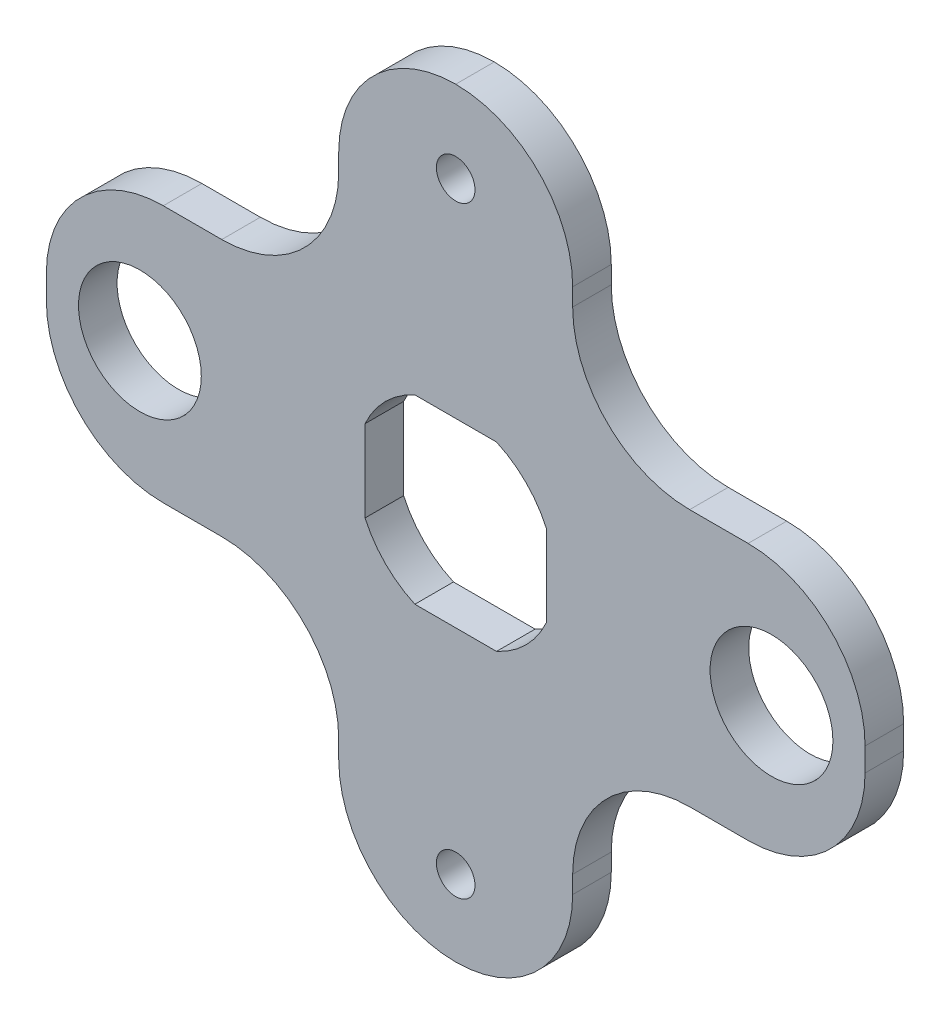
from build123d import *

# Parameters (mm, degrees)
SKETCH_1_R      = 5.25
SKETCH_1_R_2    = 1.65
EXTRUDE_1_DEPTH = 3.3
FILLET_1_R      = 10


with BuildPart() as part:
    # 草图1 → 凸台-拉伸1 (new body)
    with BuildSketch(Plane.XY):
        Polygon((-27.25, -3.25), (-27.25, 18.75), (-2.25, 18.75), (-2.25, 40.25), (17.75, 40.25), (17.75, 18.75), (42.75, 18.75), (42.75, -3.25), (17.75, -3.25), (17.75, -24.75), (-2.25, -24.75), (-2.25, -3.25), align=None)
        with Locations((34.75, 7.75)):
            Circle(SKETCH_1_R, mode=Mode.SUBTRACT)
        with Locations((-19.25, 7.75)):
            Circle(SKETCH_1_R, mode=Mode.SUBTRACT)
        with Locations((7.75, 33.25)):
            Circle(SKETCH_1_R_2, mode=Mode.SUBTRACT)
        with Locations((7.75, -18.25)):
            Circle(SKETCH_1_R_2, mode=Mode.SUBTRACT)
        with BuildLine():
            Line((4.258939989, 0), (11.241060011, 0))
            ThreePointArc((11.241060011, 0), (13.76040764, 1.73959236), (15.5, 4.258939989))
            Line((15.5, 4.258939989), (15.5, 11.241060011))
            ThreePointArc((15.5, 11.241060011), (13.76040764, 13.76040764), (11.241060011, 15.5))
            Line((11.241060011, 15.5), (4.258939989, 15.5))
            ThreePointArc((4.258939989, 15.5), (1.73959236, 13.76040764), (0, 11.241060011))
            Line((0, 11.241060011), (0, 4.258939989))
            ThreePointArc((0, 4.258939989), (1.73959236, 1.73959236), (4.258939989, 0))
        make_face(mode=Mode.SUBTRACT)
    extrude(amount=EXTRUDE_1_DEPTH)

    # 圆角1
    fillet_1_edges = [part.edges().sort_by_distance(p)[0] for p in [
        (-27.25, 18.75, 1.65),
        (-27.25, -3.25, 1.65),
        (-2.25, -3.25, 1.65),
        (-2.25, -24.75, 1.65),
        (17.75, -24.75, 1.65),
        (17.75, -3.25, 1.65),
        (42.75, -3.25, 1.65),
        (42.75, 18.75, 1.65),
        (17.75, 18.75, 1.65),
        (-2.25, 18.75, 1.65),
        (-2.25, 40.25, 1.65),
        (17.75, 40.25, 1.65),
    ]]
    fillet(fillet_1_edges, radius=FILLET_1_R - 0.0001)  # a hair under: the kernel refuses the full size


solid = part.part
